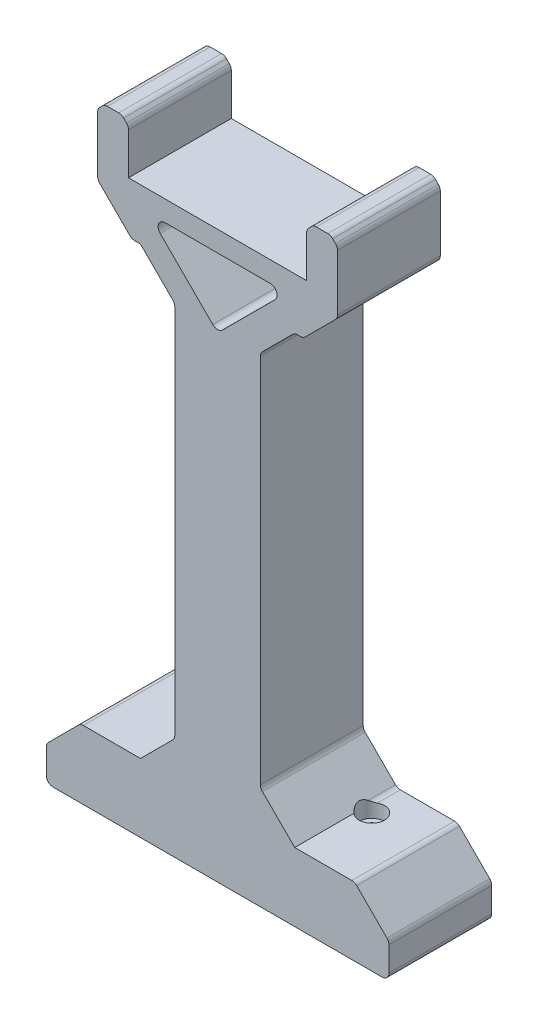
from build123d import *

# Parameters (mm, degrees)
EXTRUDE_1_DEPTH     = 30
SKETCH_3_W          = 52
SKETCH_3_H          = 30
CUT_EXTRUDE_1_DEPTH = 190.208879284
SKETCH_4_W          = 80
SKETCH_4_H          = 20
CUT_EXTRUDE_2_DEPTH = 25
SKETCH_5_R          = 2.15
CUT_EXTRUDE_3_DEPTH = 171.293863659
SKETCH_6_R          = 3.7
CUT_EXTRUDE_4_DEPTH = 4
CHAMFER_1_SIZE      = 10
CHAMFER_2_SIZE      = 2
FILLET_1_R          = 2
CUT_EXTRUDE_5_DEPTH = 190.208879284
FILLET_2_R          = 2


with BuildPart() as part:
    # 草图2 → 凸台-拉伸1 (new body)
    with BuildSketch(Plane.XY):
        Polygon((-35, 180), (35, 180), (35, 150), (12.5, 150), (12.5, 20), (50, 20), (50, 0), (-50, 0), (-50, 20), (-12.5, 20), (-12.5, 150), (-35, 150), align=None)
    extrude(amount=EXTRUDE_1_DEPTH)

    # 草图3 → 切除-拉伸1 (cut, through all)
    with BuildSketch(Plane(origin=(0, 0, 30), x_dir=(-1, 0, 0), z_dir=(0, 0, -1))):
        with Locations((0, 180)):
            Rectangle(SKETCH_3_W, SKETCH_3_H)
    extrude(amount=CUT_EXTRUDE_1_DEPTH, mode=Mode.SUBTRACT)

    # 草图4 → 切除-拉伸2 (cut)
    with BuildSketch(Plane(origin=(0, 0, 0), x_dir=(-1, 0, 0), z_dir=(0, 0, -1))):
        Rectangle(SKETCH_4_W, SKETCH_4_H)
    extrude(amount=-CUT_EXTRUDE_2_DEPTH, mode=Mode.SUBTRACT)

    # 草图5 → 切除-拉伸3 (cut, through all)
    with BuildSketch(Plane(origin=(0, 20, 0), x_dir=(1, 0, 0), z_dir=(0, 1, 0))):
        with Locations(Location((-25, -10, 0), (0, 0, 180))):
            Circle(SKETCH_5_R)
        with Locations(Location((25, -10, 0), (0, 0, 180))):
            Circle(SKETCH_5_R)
    extrude(amount=-CUT_EXTRUDE_3_DEPTH, mode=Mode.SUBTRACT)

    # 草图6 → 切除-拉伸4 (cut)
    with BuildSketch(Plane(origin=(0, 20, 0), x_dir=(1, 0, 0), z_dir=(0, 1, 0))):
        with Locations(Location((25, -10, 0), (0, 0, 180))):
            Circle(SKETCH_6_R)
        with Locations(Location((-25, -10, 0), (0, 0, 180))):
            Circle(SKETCH_6_R)
    extrude(amount=-CUT_EXTRUDE_4_DEPTH, mode=Mode.SUBTRACT)

    # 倒角1
    # the kernel refuses this chamfer: 10 mm, written as the material it adds along each edge
    with BuildSketch(Plane(origin=(12.5, 150, 0), x_dir=(-0.027495876610586452, -0.9996219169112968, 0), z_dir=(0, 0, 1)), Plane(origin=(-12.5, 150, 0), x_dir=(-0.9996219169112968, 0.0274958766105877, 0), z_dir=(0, 0, 1))) as chamfer_1_piece_1:
        Polygon((CHAMFER_1_SIZE * 0.999621916911, CHAMFER_1_SIZE * 0.0274958766106), (-CHAMFER_1_SIZE * 0.0274958766106, CHAMFER_1_SIZE * 0.999621916911), (0, 0), align=None)
    extrude(amount=30)
    with BuildSketch(Plane(origin=(12.5, 20, 0), x_dir=(0.9996219169112968, -0.027495876610586313, 0), z_dir=(0, 0, 1))) as chamfer_1_piece_2_section:
        Polygon((CHAMFER_1_SIZE * 0.999621916911, CHAMFER_1_SIZE * 0.0274958766106), (-CHAMFER_1_SIZE * 0.0274958766106, CHAMFER_1_SIZE * 0.999621916911), (0, 0), align=None)
    chamfer_1_piece_2 = extrude(amount=30, mode=Mode.PRIVATE)
    chamfer_1_piece_2 = chamfer_1_piece_2 - Plane(origin=(25, 23.307134121, 10), x_dir=(-1, 0, 0), z_dir=(0, 1, 0)) * Cylinder(3.7, 100, mode=Mode.PRIVATE)
    add(chamfer_1_piece_2)
    with BuildSketch(Plane(origin=(-12.5, 20, 0), x_dir=(0.027495876610586147, 0.9996219169112968, 0), z_dir=(0, 0, 1))) as chamfer_1_piece_3_section:
        Polygon((CHAMFER_1_SIZE * 0.999621916911, CHAMFER_1_SIZE * 0.0274958766106), (-CHAMFER_1_SIZE * 0.0274958766106, CHAMFER_1_SIZE * 0.999621916911), (0, 0), align=None)
    chamfer_1_piece_3 = extrude(amount=30, mode=Mode.PRIVATE)
    chamfer_1_piece_3 = chamfer_1_piece_3 - Plane(origin=(-25, 23.30713415, 10), x_dir=(-1, 0, 0), z_dir=(0, 1, 0)) * Cylinder(3.7, 100, mode=Mode.PRIVATE)
    add(chamfer_1_piece_3)
    # the kernel refuses this chamfer: 10 mm, written as the material it takes off along each edge
    with BuildSketch(Plane(origin=(35, 150, -25.71682988), x_dir=(-0.9996219169112968, -0.0274958766105877, 0), z_dir=(0, 0, 1)), Plane(origin=(-35, 150, -25.71682988), x_dir=(-0.027495876610586282, 0.9996219169112968, 0), z_dir=(0, 0, 1))) as chamfer_1_2_piece_1:
        Polygon((CHAMFER_1_SIZE * 0.999621916911, -CHAMFER_1_SIZE * 0.0274958766106), (-CHAMFER_1_SIZE * 0.0274958766106, -CHAMFER_1_SIZE * 0.999621916911), (0, 0), align=None)
    extrude(amount=81.433659759, mode=Mode.SUBTRACT)
    with BuildSketch(Plane(origin=(50, 20, -25.71682988), x_dir=(-0.9996219169112968, 0.027495876610586317, 0), z_dir=(0, 0, 1)), Plane(origin=(-50, 20, -25.71682988), x_dir=(-0.027495876610585626, -0.9996219169112968, 0), z_dir=(0, 0, 1))) as chamfer_1_2_piece_2:
        Polygon((CHAMFER_1_SIZE * 0.999621916911, CHAMFER_1_SIZE * 0.0274958766106), (-CHAMFER_1_SIZE * 0.0274958766106, CHAMFER_1_SIZE * 0.999621916911), (0, 0), align=None)
    extrude(amount=81.433659759, mode=Mode.SUBTRACT)

    # 倒角2
    chamfer_2_edges = [part.edges().sort_by_distance(p)[0] for p in [
        (-35, 180, 15),
        (35, 180, 15),
        (26, 180, 15),
        (-26, 180, 15),
    ]]
    chamfer(chamfer_2_edges, length=CHAMFER_2_SIZE)

    # 圆角1
    fillet_1_edges = [part.edges().sort_by_distance(p)[0] for p in [
        (-35, 160, 15),
        (-25, 150, 15),
        (-22.5, 150, 15),
        (-12.5, 140, 15),
        (-12.5, 30, 15),
        (-22.5, 20, 3.63618183),
        (-40, 20, 15),
        (-50, 10, 15),
        (-50, 0, 15),
        (-40, 0, 12.5),
        (-40, 10, 12.5),
        (40, 10, 12.5),
        (40, 0, 12.5),
        (50, 0, 15),
        (50, 10, 15),
        (40, 20, 15),
        (22.5, 20, 3.63618183),
        (12.5, 30, 15),
        (22.5, 150, 15),
        (25, 150, 15),
        (35, 160, 15),
        (35, 178, 15),
        (33, 180, 15),
        (28, 180, 15),
        (26, 178, 15),
        (-26, 178, 15),
        (-28, 180, 15),
        (-33, 180, 15),
        (-35, 178, 15),
        (12.5, 140, 15),
    ]]
    fillet(fillet_1_edges, radius=FILLET_1_R)

    # 草图7 → 切除-拉伸5 (cut, through all)
    with BuildSketch(Plane(origin=(0, 0, 0), x_dir=(-1, 0, 0), z_dir=(0, 0, -1))):
        Polygon((-20.186291501, 159), (0, 138.813708499), (20.186291501, 159), align=None)
    extrude(amount=-CUT_EXTRUDE_5_DEPTH, mode=Mode.SUBTRACT)

    # 圆角2
    fillet_2_edges = [part.edges().sort_by_distance(p)[0] for p in [
        (20.186291501, 159, 15),
        (-20.186291501, 159, 15),
        (0, 138.813708499, 15),
    ]]
    fillet(fillet_2_edges, radius=FILLET_2_R)


solid = part.part
